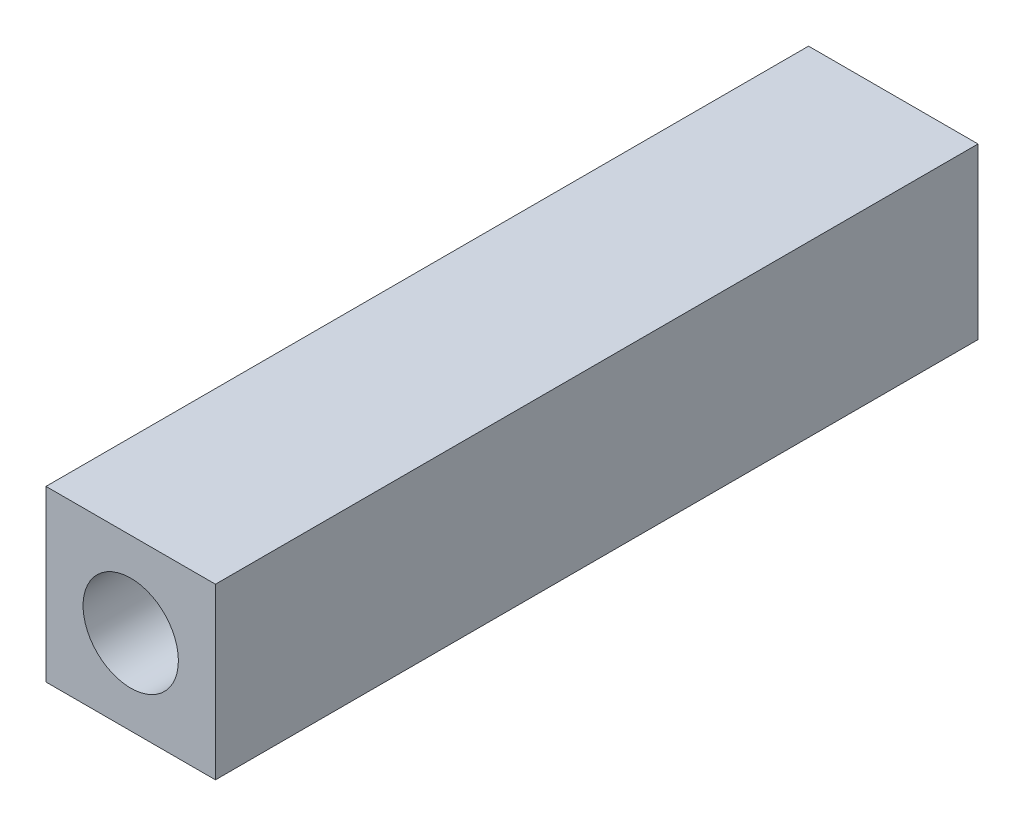
from build123d import *

# Parameters (mm, degrees)
SKETCH1_W           = 25.4
SKETCH1_H           = 25.4
BOSS_EXTRUDE1_DEPTH = 114.3
SKETCH3_R           = 5.1054
CUT_EXTRUDE2_DEPTH  = 109.18134035
CUT_EXTRUDE3_REACH  = 119.775
SKETCH4_R           = 4.445
SKETCH5_R           = 7.14375
CUT_EXTRUDE4_DEPTH  = 20.066


with BuildPart() as part:
    # Sketch1 → Boss-Extrude1 (new body)
    with BuildSketch(Plane.XY):
        Rectangle(SKETCH1_W, SKETCH1_H)
    extrude(amount=BOSS_EXTRUDE1_DEPTH)

    # Sketch3 → Cut-Extrude2 (cut, through all)
    with BuildSketch(Plane(origin=(0, 0, 7.62), x_dir=(-1, 0, 0), z_dir=(0, 0, -1))):
        Circle(SKETCH3_R)
    extrude(amount=-CUT_EXTRUDE2_DEPTH, mode=Mode.SUBTRACT)

    # Sketch4 → Cut-Extrude3 (cut, up to next)
    with BuildSketch(Plane.ZY.offset(12.7), mode=Mode.PRIVATE) as cut_extrude3_sk1:
        with Locations((16.5354, 0)):
            Circle(SKETCH4_R)
    cut_extrude3_tool1 = extrude(cut_extrude3_sk1.sketch, amount=-CUT_EXTRUDE3_REACH, mode=Mode.PRIVATE) & part.part
    # Sketch4 → Cut-Extrude3 (cut, up to next)
    with BuildSketch(Plane.ZY.offset(12.7), mode=Mode.PRIVATE) as cut_extrude3_sk2:
        with Locations((33.0454, 0)):
            Circle(SKETCH4_R)
    cut_extrude3_tool2 = extrude(cut_extrude3_sk2.sketch, amount=-CUT_EXTRUDE3_REACH, mode=Mode.PRIVATE) & part.part
    # Sketch4 → Cut-Extrude3 (cut, up to next)
    with BuildSketch(Plane.ZY.offset(12.7), mode=Mode.PRIVATE) as cut_extrude3_sk3:
        with Locations((49.5554, 0)):
            Circle(SKETCH4_R)
    cut_extrude3_tool3 = extrude(cut_extrude3_sk3.sketch, amount=-CUT_EXTRUDE3_REACH, mode=Mode.PRIVATE) & part.part
    # Sketch4 → Cut-Extrude3 (cut, up to next)
    with BuildSketch(Plane.ZY.offset(12.7), mode=Mode.PRIVATE) as cut_extrude3_sk4:
        with Locations((66.0654, 0)):
            Circle(SKETCH4_R)
    cut_extrude3_tool4 = extrude(cut_extrude3_sk4.sketch, amount=-CUT_EXTRUDE3_REACH, mode=Mode.PRIVATE) & part.part
    # Sketch4 → Cut-Extrude3 (cut, up to next)
    with BuildSketch(Plane.ZY.offset(12.7), mode=Mode.PRIVATE) as cut_extrude3_sk5:
        with Locations((82.5754, 0)):
            Circle(SKETCH4_R)
    cut_extrude3_tool5 = extrude(cut_extrude3_sk5.sketch, amount=-CUT_EXTRUDE3_REACH, mode=Mode.PRIVATE) & part.part
    add(cut_extrude3_tool1.solids().sort_by_distance((-12.7, 0, 16.5354))[0], mode=Mode.SUBTRACT)
    add(cut_extrude3_tool2.solids().sort_by_distance((-12.7, 0, 33.0454))[0], mode=Mode.SUBTRACT)
    add(cut_extrude3_tool3.solids().sort_by_distance((-12.7, 0, 49.5554))[0], mode=Mode.SUBTRACT)
    add(cut_extrude3_tool4.solids().sort_by_distance((-12.7, 0, 66.0654))[0], mode=Mode.SUBTRACT)
    add(cut_extrude3_tool5.solids().sort_by_distance((-12.7, 0, 82.5754))[0], mode=Mode.SUBTRACT)

    # Sketch5 → Cut-Extrude4 (cut)
    with BuildSketch(Plane.XY.offset(114.3)):
        Circle(SKETCH5_R)
    extrude(amount=-CUT_EXTRUDE4_DEPTH, mode=Mode.SUBTRACT)


solid = part.part
